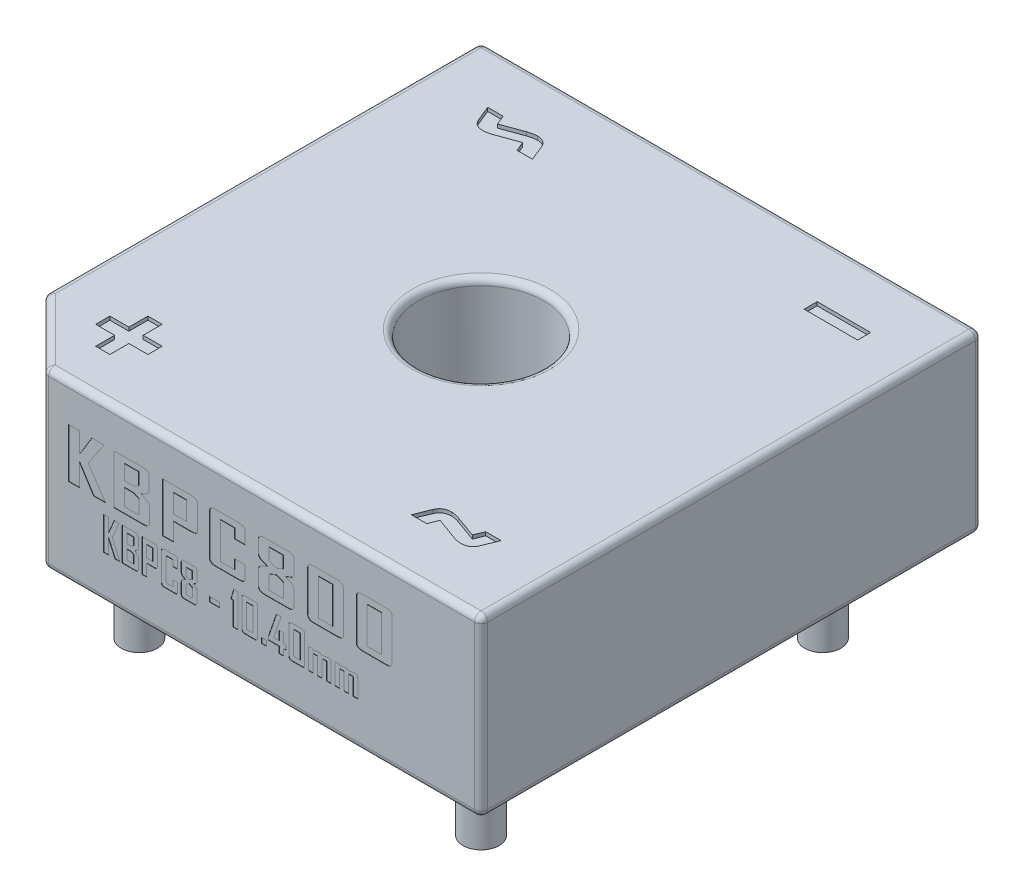
from build123d import *

# Parameters (mm, degrees)
BODY_SKETCH_W          = 15.24
BODY_SKETCH_H          = 15.24
BODY_SKETCH_R          = 1.905
BODY_MAIN_DEPTH        = 5.334
BODY_CHAMFER_SIZE      = 2
SKETCH24_R             = 2.405
BODY_CUT_DEPTH         = 2
BODY_REVOLVE_CUT_REACH = 22.831
BODY_FILLET_R          = 0.2
PIN_B1_SKETCH_R        = 0.55
CIRPATTERN1_COUNT      = 4
TEXT_START             = 2.41
TEXT_2_OUTLINE_W       = 0.192771084
TEXT_2_OUTLINE_H       = 0.710843374
TEXT_2_OUTLINE_W_2     = 0.43373494
TEXT_2_OUTLINE_H_2     = 1.102409638
TEXT_2_OUTLINE_W_3     = 0.397590362
TEXT_2_OUTLINE_H_3     = 0.560240964
TEXT_2_OUTLINE_W_4     = 0.180722891
TEXT_2_OUTLINE_H_4     = 0.349397591
TEXT_2_OUTLINE_W_5     = 0.144578313
TEXT_2_OUTLINE_H_5     = 0.156626506
TEXT_2_OUTLINE_W_6     = 0.301204819
TEXT_2_OUTLINE_H_6     = 0.144578314
TEXT_2_DEPTH           = 0.01
SKETCH23_W             = 1.626506024
SKETCH23_H             = 0.397590362
TEXT1_DEPTH            = 0.11
PIN1_MARK_DEPTH        = 0.04


# Read off the part's stored shape, not the designer's step: text
with BuildPart() as part:
    # BODY_Sketch → BODY_MAIN (new body)
    with BuildSketch(Plane(origin=(0, 0.1, 0), x_dir=(1, 0, 0), z_dir=(0, 1, 0))):
        with Locations((5.2, 5.2)):
            Rectangle(BODY_SKETCH_W, BODY_SKETCH_H)
        with Locations(Location((5.2, 5.2, 0), (0, 0, 90))):
            Circle(BODY_SKETCH_R, mode=Mode.SUBTRACT)
    extrude(amount=BODY_MAIN_DEPTH)

    # BODY_Chamfer
    body_chamfer_edges = [part.edges().sort_by_distance(p)[0] for p in [
        (-2.42, 2.767, 2.42),
    ]]
    chamfer(body_chamfer_edges, length=BODY_CHAMFER_SIZE)

    # Sketch24 → BODY_Cut (cut)
    with BuildSketch(Plane(origin=(0, 0.1, 0), x_dir=(1, 0, 0), z_dir=(0, 1, 0))):
        Polygon((-0.005786438, -1.42), (11.82, -1.42), (11.82, 11.82), (-1.42, 11.82), (-1.42, -0.005786438), align=None)
        with Locations(Location((5.2, 5.2, 0), (0, 0, 270))):
            Circle(SKETCH24_R, mode=Mode.SUBTRACT)
    extrude(amount=BODY_CUT_DEPTH, mode=Mode.SUBTRACT)

    # Sketch26 → BODY_Revolve (revolve)
    with BuildSketch(Plane(origin=(0, 0, 0), x_dir=(0, -1, 0), z_dir=(0.7071067811865455, 0, 0.7071067811865496)), mode=Mode.PRIVATE) as body_revolve_sk:
        with BuildLine():
            Line((-0.4, 16.716004307), (-2.3, 16.716004307))
            Line((-2.3, 16.716004307), (-2.3, 9.758910524))
            Line((-2.3, 9.758910524), (-0.4, 9.758910524))
            add(Edge.make_bspline(
                [(-0.4, 16.716004307), (-0.4, 16.18992751), (-0.85737047, 13.209966353), (-3.515826154, 10.386282777), (-0.4, 9.758910524)],
                knots=[0, 0, 0, 0, 0.257350515, 1, 1, 1, 1], degree=3))
        make_face()
    revolve(body_revolve_sk.sketch.rotate(Axis((5.2, 9.583169558, -5.2), (0, -1, 0)), 135), axis=Axis((5.2, 9.583169558, -5.2), (0, -1, 0)))

    # Sketch28 → BODY_Revolve_Cut (cut, up to next)
    with BuildSketch(Plane(origin=(0, 2.3, 0), x_dir=(1, 0, 0), z_dir=(0, 1, 0)), mode=Mode.PRIVATE) as body_revolve_cut_sk1:
        with BuildLine():
            Line((-2.42, -0.239154346), (-2.42, 10.639154346))
            ThreePointArc((-2.42, 10.639154346), (-4.162093783, 5.2), (-2.42, -0.239154346))
        make_face()
    body_revolve_cut_tool1 = extrude(body_revolve_cut_sk1.sketch, amount=-BODY_REVOLVE_CUT_REACH, mode=Mode.PRIVATE) & part.part
    # Sketch28 → BODY_Revolve_Cut (cut, up to next)
    with BuildSketch(Plane(origin=(0, 2.3, 0), x_dir=(1, 0, 0), z_dir=(0, 1, 0)), mode=Mode.PRIVATE) as body_revolve_cut_sk2:
        with BuildLine():
            Line((12.82, 10.639154346), (12.82, -0.239154346))
            ThreePointArc((12.82, -0.239154346), (14.562093783, 5.2), (12.82, 10.639154346))
        make_face()
    body_revolve_cut_tool2 = extrude(body_revolve_cut_sk2.sketch, amount=-BODY_REVOLVE_CUT_REACH, mode=Mode.PRIVATE) & part.part
    # Sketch28 → BODY_Revolve_Cut (cut, up to next)
    with BuildSketch(Plane(origin=(0, 2.3, 0), x_dir=(1, 0, 0), z_dir=(0, 1, 0)), mode=Mode.PRIVATE) as body_revolve_cut_sk3:
        with BuildLine():
            Line((10.639154346, -2.42), (-0.239154346, -2.42))
            ThreePointArc((-0.239154346, -2.42), (5.2, -4.162093783), (10.639154346, -2.42))
        make_face()
    body_revolve_cut_tool3 = extrude(body_revolve_cut_sk3.sketch, amount=-BODY_REVOLVE_CUT_REACH, mode=Mode.PRIVATE) & part.part
    # Sketch28 → BODY_Revolve_Cut (cut, up to next)
    with BuildSketch(Plane(origin=(0, 2.3, 0), x_dir=(1, 0, 0), z_dir=(0, 1, 0)), mode=Mode.PRIVATE) as body_revolve_cut_sk4:
        with BuildLine():
            ThreePointArc((10.639154346, 12.82), (5.2, 14.562093783), (-0.239154346, 12.82))
            Line((-0.239154346, 12.82), (10.639154346, 12.82))
        make_face()
    body_revolve_cut_tool4 = extrude(body_revolve_cut_sk4.sketch, amount=-BODY_REVOLVE_CUT_REACH, mode=Mode.PRIVATE) & part.part
    add(body_revolve_cut_tool1.solids().sort_by_distance((-3.122712, 2.3, -5.2))[0], mode=Mode.SUBTRACT)
    add(body_revolve_cut_tool2.solids().sort_by_distance((13.522712, 2.3, -5.2))[0], mode=Mode.SUBTRACT)
    add(body_revolve_cut_tool3.solids().sort_by_distance((5.2, 2.3, 3.122712))[0], mode=Mode.SUBTRACT)
    add(body_revolve_cut_tool4.solids().sort_by_distance((5.2, 2.3, -13.522712))[0], mode=Mode.SUBTRACT)

    # BODY_Fillet
    body_fillet_edges = [part.edges().sort_by_distance(p)[0] for p in [
        (5.2, 5.434, -3.295),
        (12.82, 5.434, -5.2),
        (5.2, 5.434, -12.82),
        (6.2, 0.1, 2.42),
        (6.2, 5.434, 2.42),
        (-0.42, 2.767, 2.42),
        (-1.42, 0.1, 1.42),
        (-2.42, 2.767, 0.42),
        (-1.42, 5.434, 1.42),
        (-2.42, 5.434, -6.2),
        (5.2, 0.1, -12.82),
        (12.82, 0.1, -5.2),
        (-2.42, 0.1, -6.2),
        (-2.42, 2.767, -12.82),
        (12.82, 2.767, -12.82),
        (12.82, 2.767, 2.42),
    ]]
    fillet(body_fillet_edges, radius=BODY_FILLET_R)

    # PIN_Sweep: sweep along a path in PIN_B1_Path
    with BuildLine(Plane(origin=(0, 0, 0), x_dir=(0, 0, -1), z_dir=(1, 0, 0))) as pin_sweep_path:
        Line((0, -2.7), (0, 0))
        Line((0, 0), (0, 2.767))
    # PIN_B1_Sketch → PIN_Sweep (sweep)
    with BuildSketch(Plane(origin=(0, 0, 0), x_dir=(1, 0, 0), z_dir=(0, 1, 0))):
        Circle(PIN_B1_SKETCH_R)
    pin_sweep = sweep(path=pin_sweep_path.line)

    # CirPattern1: PIN_Sweep ×4 about axis
    cirpattern1_axis = Axis((5.2, 0, -5.2), (0, 1, 0))
    for i in range(1, CIRPATTERN1_COUNT):
        add(pin_sweep.rotate(cirpattern1_axis, i * 360 / CIRPATTERN1_COUNT))

    # text 2 outline → text 2 (cut)
    # profile 1 of 20: a face of its own
    with BuildSketch(Plane.XY.offset(TEXT_START)):
        with BuildLine():
            add(Edge.make_bspline(
                [(8.513253012, 2.038921687), (8.529255245, 2.042432438), (8.561199851, 2.049440808), (8.593135762, 2.056488688), (8.609073795, 2.060006024)],
                knots=[0, 0, 0, 0, 0.500936953, 1, 1, 1, 1], degree=3))
            Line((8.513253012, 2.038921687), (8.513253012, 2.072054217))
            Line((8.513253012, 2.072054217), (8.368674699, 2.072054217))
            Line((8.368674699, 2.072054217), (8.368674699, 1.4335))
            Line((8.368674699, 1.4335), (8.513253012, 1.4335))
            Line((8.513253012, 1.4335), (8.513253012, 1.950066265))
            Line((8.513253012, 1.950066265), (8.645783133, 1.951572289))
            Line((8.645783133, 1.951572289), (8.645783133, 1.4335))
            Line((8.645783133, 1.4335), (8.790361446, 1.4335))
            Line((8.790361446, 1.4335), (8.790361446, 1.950066265))
            Line((8.790361446, 1.950066265), (8.922891566, 1.951572289))
            Line((8.922891566, 1.951572289), (8.922891566, 1.4335))
            Line((8.922891566, 1.4335), (9.06746988, 1.4335))
            Line((9.06746988, 1.4335), (9.06746988, 1.993176205))
            add(Edge.make_bspline(
                [(8.98313253, 2.072054217), (8.989617158, 2.071753553), (9.001902697, 2.071183926), (9.019087718, 2.067281632), (9.033740797, 2.060818334), (9.045942795, 2.052070007), (9.055528557, 2.040703183), (9.062275757, 2.026869843), (9.066417415, 2.010724643), (9.067107031, 1.999226215), (9.06746988, 1.993176205)],
                knots=[0, 0, 0, 0, 0.148290832, 0.280946377, 0.400455298, 0.512425211, 0.621411208, 0.736958176, 0.861597969, 1, 1, 1, 1], degree=3))
            add(Edge.make_bspline(
                [(8.87940512, 2.057746988), (8.889996883, 2.059889603), (8.909871982, 2.06391015), (8.937800305, 2.06846172), (8.961801885, 2.071319783), (8.976475092, 2.071824995), (8.98313253, 2.072054217)],
                knots=[0, 0, 0, 0, 0.309141697, 0.580094407, 0.809483008, 1, 1, 1, 1], degree=3))
            add(Edge.make_bspline(
                [(8.776995482, 2.036286145), (8.794070044, 2.03977019), (8.82824439, 2.046743426), (8.862343155, 2.05407733), (8.87940512, 2.057746988)],
                knots=[0, 0, 0, 0, 0.499630991, 1, 1, 1, 1], degree=3))
            add(Edge.make_bspline(
                [(8.706024096, 2.072054217), (8.710423382, 2.071959163), (8.718818554, 2.071777772), (8.730808863, 2.070049379), (8.741601876, 2.067328311), (8.751109743, 2.063277842), (8.759641446, 2.058420693), (8.766742267, 2.052130731), (8.772885402, 2.044867551), (8.775607684, 2.039183717), (8.776995482, 2.036286145)],
                knots=[0, 0, 0, 0, 0.156270314, 0.29821119, 0.429671568, 0.550627586, 0.664617534, 0.776870433, 0.88625033, 1, 1, 1, 1], degree=3))
            add(Edge.make_bspline(
                [(8.609073795, 2.060006024), (8.618346503, 2.061846616), (8.636081608, 2.065366955), (8.66158936, 2.069078016), (8.684640438, 2.0715487), (8.69917894, 2.071892395), (8.706024096, 2.072054217)],
                knots=[0, 0, 0, 0, 0.289803378, 0.554281819, 0.790142707, 1, 1, 1, 1], degree=3))
        make_face()
    # profile 2 of 20: a face of its own
    with BuildSketch(Plane.XY.offset(TEXT_START)):
        with BuildLine():
            add(Edge.make_bspline(
                [(7.706024096, 2.038921687), (7.72202633, 2.042432438), (7.753970935, 2.049440808), (7.785906846, 2.056488688), (7.80184488, 2.060006024)],
                knots=[0, 0, 0, 0, 0.500936953, 1, 1, 1, 1], degree=3))
            Line((7.706024096, 2.038921687), (7.706024096, 2.072054217))
            Line((7.706024096, 2.072054217), (7.561445783, 2.072054217))
            Line((7.561445783, 2.072054217), (7.561445783, 1.4335))
            Line((7.561445783, 1.4335), (7.706024096, 1.4335))
            Line((7.706024096, 1.4335), (7.706024096, 1.950066265))
            Line((7.706024096, 1.950066265), (7.838554217, 1.951572289))
            Line((7.838554217, 1.951572289), (7.838554217, 1.4335))
            Line((7.838554217, 1.4335), (7.98313253, 1.4335))
            Line((7.98313253, 1.4335), (7.98313253, 1.950066265))
            Line((7.98313253, 1.950066265), (8.115662651, 1.951572289))
            Line((8.115662651, 1.951572289), (8.115662651, 1.4335))
            Line((8.115662651, 1.4335), (8.260240964, 1.4335))
            Line((8.260240964, 1.4335), (8.260240964, 1.993176205))
            add(Edge.make_bspline(
                [(8.175903614, 2.072054217), (8.182388243, 2.071753553), (8.194673782, 2.071183926), (8.211858802, 2.067281632), (8.226511881, 2.060818334), (8.238713879, 2.052070007), (8.248299641, 2.040703183), (8.255046842, 2.026869843), (8.259188499, 2.010724643), (8.259878115, 1.999226215), (8.260240964, 1.993176205)],
                knots=[0, 0, 0, 0, 0.148290832, 0.280946377, 0.400455298, 0.512425211, 0.621411208, 0.736958176, 0.861597969, 1, 1, 1, 1], degree=3))
            add(Edge.make_bspline(
                [(8.072176205, 2.057746988), (8.082767967, 2.059889603), (8.102643066, 2.06391015), (8.130571389, 2.06846172), (8.15457297, 2.071319783), (8.169246177, 2.071824995), (8.175903614, 2.072054217)],
                knots=[0, 0, 0, 0, 0.309141697, 0.580094407, 0.809483008, 1, 1, 1, 1], degree=3))
            add(Edge.make_bspline(
                [(7.969766566, 2.036286145), (7.986841128, 2.03977019), (8.021015474, 2.046743426), (8.055114239, 2.05407733), (8.072176205, 2.057746988)],
                knots=[0, 0, 0, 0, 0.499630991, 1, 1, 1, 1], degree=3))
            add(Edge.make_bspline(
                [(7.898795181, 2.072054217), (7.903194466, 2.071959163), (7.911589639, 2.071777772), (7.923579947, 2.070049379), (7.93437296, 2.067328311), (7.943880827, 2.063277842), (7.95241253, 2.058420693), (7.959513351, 2.052130731), (7.965656486, 2.044867551), (7.968378768, 2.039183717), (7.969766566, 2.036286145)],
                knots=[0, 0, 0, 0, 0.156270314, 0.29821119, 0.429671568, 0.550627586, 0.664617534, 0.776870433, 0.88625033, 1, 1, 1, 1], degree=3))
            add(Edge.make_bspline(
                [(7.80184488, 2.060006024), (7.811117587, 2.061846616), (7.828852692, 2.065366955), (7.854360445, 2.069078016), (7.877411522, 2.0715487), (7.891950024, 2.071892395), (7.898795181, 2.072054217)],
                knots=[0, 0, 0, 0, 0.289803378, 0.554281819, 0.790142707, 1, 1, 1, 1], degree=3))
        make_face()
    # profile 3 of 20: a face of its own
    with BuildSketch(Plane.XY.offset(TEXT_START)):
        with BuildLine():
            add(Edge.make_bspline(
                [(7.453012048, 1.512378012), (7.45258675, 1.506385605), (7.451783459, 1.495067306), (7.447521289, 1.479288213), (7.441267364, 1.465565602), (7.432047344, 1.454464704), (7.420946446, 1.445244684), (7.407223835, 1.438990759), (7.391444742, 1.434728589), (7.380126444, 1.433925298), (7.374134036, 1.4335)],
                knots=[0, 0, 0, 0, 0.143087679, 0.270260174, 0.38817721, 0.5, 0.61182279, 0.729739826, 0.856912321, 1, 1, 1, 1], degree=3))
            Line((7.453012048, 1.512378012), (7.453012048, 2.354621988))
            add(Edge.make_bspline(
                [(7.374134036, 2.4335), (7.380126444, 2.433074702), (7.391444742, 2.432271411), (7.407223835, 2.428009241), (7.420946446, 2.421755316), (7.432047344, 2.412535296), (7.441267364, 2.401434398), (7.447521289, 2.387711787), (7.451783459, 2.371932694), (7.45258675, 2.360614395), (7.453012048, 2.354621988)],
                knots=[0, 0, 0, 0, 0.143087679, 0.270260174, 0.38817721, 0.5, 0.61182279, 0.729739826, 0.856912321, 1, 1, 1, 1], degree=3))
            Line((7.374134036, 2.4335), (7.052033133, 2.4335))
            add(Edge.make_bspline(
                [(6.971084337, 2.354621988), (6.971492646, 2.360617466), (6.972264978, 2.371958173), (6.976759298, 2.387740236), (6.983239658, 2.401376024), (6.992434459, 2.412669706), (7.003948644, 2.421741146), (7.018060836, 2.428049964), (7.034298158, 2.432241356), (7.045918451, 2.433066044), (7.052033133, 2.4335)],
                knots=[0, 0, 0, 0, 0.141191735, 0.267070268, 0.384070853, 0.494411966, 0.607065164, 0.726092805, 0.855868051, 1, 1, 1, 1], degree=3))
            Line((6.971084337, 2.354621988), (6.971084337, 1.512378012))
            add(Edge.make_bspline(
                [(7.049962349, 1.4335), (7.043969942, 1.433925298), (7.032651643, 1.434728589), (7.01687255, 1.438990759), (7.003149939, 1.445244684), (6.992049041, 1.454464704), (6.982829022, 1.465565602), (6.976575096, 1.479288213), (6.972312926, 1.495067306), (6.971509635, 1.506385605), (6.971084337, 1.512378012)],
                knots=[0, 0, 0, 0, 0.143087679, 0.270260174, 0.38817721, 0.5, 0.61182279, 0.729739826, 0.856912321, 1, 1, 1, 1], degree=3))
            Line((7.049962349, 1.4335), (7.374134036, 1.4335))
        make_face()
        with Locations((7.212048193, 1.9335)):
            Rectangle(TEXT_2_OUTLINE_W, TEXT_2_OUTLINE_H, mode=Mode.SUBTRACT)
    # profile 4 of 20: a face of its own
    with BuildSketch(Plane.XY.offset(TEXT_START)):
        with BuildLine():
            add(Edge.make_bspline(
                [(2.392771084, 1.512378012), (2.392345787, 1.506385605), (2.391542495, 1.495067306), (2.387280325, 1.479288213), (2.3810264, 1.465565602), (2.371806381, 1.454464704), (2.360705483, 1.445244684), (2.346982872, 1.438990759), (2.331203778, 1.434728589), (2.31988548, 1.433925298), (2.313893072, 1.4335)],
                knots=[0, 0, 0, 0, 0.143087679, 0.270260174, 0.38817721, 0.5, 0.61182279, 0.729739826, 0.856912321, 1, 1, 1, 1], degree=3))
            Line((2.392771084, 1.512378012), (2.392771084, 1.791745482))
            add(Edge.make_bspline(
                [(2.359450301, 1.883048193), (2.364565408, 1.877158419), (2.37488931, 1.865270995), (2.385406677, 1.843359827), (2.391745847, 1.818522305), (2.392418701, 1.800948922), (2.392771084, 1.791745482)],
                knots=[0, 0, 0, 0, 0.233880582, 0.472044868, 0.723502121, 1, 1, 1, 1], degree=3))
            add(Edge.make_bspline(
                [(2.28189006, 1.939524096), (2.287665543, 1.93544868), (2.298477373, 1.92781941), (2.313551409, 1.917107842), (2.326363885, 1.90781161), (2.33716695, 1.900131347), (2.345775158, 1.893719876), (2.352323503, 1.888861372), (2.356743408, 1.885570977), (2.358767539, 1.883684517), (2.359450301, 1.883048193)],
                knots=[0, 0, 0, 0, 0.220969595, 0.413659948, 0.578075155, 0.71580951, 0.828017936, 0.913546243, 0.970838158, 1, 1, 1, 1], degree=3))
            add(Edge.make_bspline(
                [(2.357003012, 1.993740964), (2.356323502, 1.993100396), (2.354336689, 1.991227444), (2.349950168, 1.988245561), (2.343654109, 1.983640383), (2.335517213, 1.977324153), (2.324796245, 1.970218835), (2.312503122, 1.960948222), (2.297809177, 1.950783934), (2.28740488, 1.943424814), (2.28189006, 1.939524096)],
                knots=[0, 0, 0, 0, 0.030202642, 0.08830924, 0.171209504, 0.28295023, 0.421594497, 0.587395026, 0.781297856, 1, 1, 1, 1], degree=3))
            add(Edge.make_bspline(
                [(2.387688253, 2.080902108), (2.387395914, 2.072010421), (2.386839236, 2.055078628), (2.380771634, 2.031321691), (2.371446672, 2.010324722), (2.361751265, 1.999192759), (2.357003012, 1.993740964)],
                knots=[0, 0, 0, 0, 0.28088772, 0.534874023, 0.772208062, 1, 1, 1, 1], degree=3))
            Line((2.387688253, 2.080902108), (2.387688253, 2.354621988))
            add(Edge.make_bspline(
                [(2.31125753, 2.4335), (2.317059934, 2.433067036), (2.328064573, 2.43224589), (2.343382782, 2.428060369), (2.356613843, 2.421684364), (2.367336926, 2.412533749), (2.376077999, 2.401304639), (2.382458926, 2.387757878), (2.386386183, 2.371894033), (2.387237104, 2.360606512), (2.387688253, 2.354621988)],
                knots=[0, 0, 0, 0, 0.140866031, 0.267161677, 0.382887924, 0.494174249, 0.60591769, 0.725745796, 0.854593311, 1, 1, 1, 1], degree=3))
            Line((2.31125753, 2.4335), (1.898795181, 2.4335))
            Line((1.898795181, 2.4335), (1.898795181, 1.4335))
            Line((1.898795181, 1.4335), (2.313893072, 1.4335))
        make_face()
        Polygon((2.248192771, 1.578078313), (2.043373494, 1.578078313), (2.043373494, 1.86723494), (2.173832831, 1.86723494), (2.248192771, 1.825066265), align=None, mode=Mode.SUBTRACT)
        Polygon((2.043373494, 2.288921687), (2.24310994, 2.288921687), (2.24310994, 2.060194277), (2.171385542, 2.011813253), (2.043373494, 2.011813253), align=None, mode=Mode.SUBTRACT)
    # profile 5 of 20: a face of its own
    with BuildSketch(Plane.XY.offset(TEXT_START)):
        with BuildLine():
            add(Edge.make_bspline(
                [(10.112048193, 2.885317018), (10.111283401, 2.876278365), (10.109816531, 2.858942231), (10.100201901, 2.834990262), (10.085894656, 2.814239819), (10.065493657, 2.797744985), (10.040470357, 2.784265222), (10.010040097, 2.77505875), (9.974676035, 2.768839387), (9.949333825, 2.767639002), (9.935843373, 2.767)],
                knots=[0, 0, 0, 0, 0.114098337, 0.218840581, 0.322174175, 0.429434412, 0.547100708, 0.679564678, 0.829422238, 1, 1, 1, 1], degree=3))
            Line((10.112048193, 2.885317018), (10.112048193, 4.148682982))
            add(Edge.make_bspline(
                [(9.935843373, 4.267), (9.949333825, 4.266360998), (9.974676035, 4.265160613), (10.010040097, 4.25894125), (10.040470357, 4.249734778), (10.065493657, 4.236255015), (10.085894656, 4.219760181), (10.100201901, 4.199009738), (10.109816531, 4.175057769), (10.111283401, 4.157721635), (10.112048193, 4.148682982)],
                knots=[0, 0, 0, 0, 0.170577762, 0.320435322, 0.452899292, 0.570565588, 0.677825825, 0.781159419, 0.885901663, 1, 1, 1, 1], degree=3))
            Line((9.935843373, 4.267), (9.208151355, 4.267))
            add(Edge.make_bspline(
                [(9.027710843, 4.148682982), (9.028450034, 4.157731136), (9.029870642, 4.175120262), (9.039879622, 4.199024646), (9.054457701, 4.219874026), (9.075447812, 4.236244688), (9.101001586, 4.249729829), (9.132164303, 4.259009226), (9.168389602, 4.265121642), (9.194380995, 4.266349484), (9.208151355, 4.267)],
                knots=[0, 0, 0, 0, 0.112348161, 0.215915455, 0.318343111, 0.425762474, 0.543690884, 0.676356302, 0.828532073, 1, 1, 1, 1], degree=3))
            Line((9.027710843, 4.148682982), (9.027710843, 2.885317018))
            add(Edge.make_bspline(
                [(9.203915663, 2.767), (9.190425211, 2.767639002), (9.165083001, 2.768839387), (9.12971894, 2.77505875), (9.099288679, 2.784265222), (9.074265379, 2.797744985), (9.05386438, 2.814239819), (9.039557135, 2.834990262), (9.029942505, 2.858942231), (9.028475635, 2.876278365), (9.027710843, 2.885317018)],
                knots=[0, 0, 0, 0, 0.170577762, 0.320435322, 0.452899292, 0.570565588, 0.677825825, 0.781159419, 0.885901663, 1, 1, 1, 1], degree=3))
            Line((9.203915663, 2.767), (9.935843373, 2.767))
        make_face()
        with Locations((9.569879518, 3.517)):
            Rectangle(TEXT_2_OUTLINE_W_2, TEXT_2_OUTLINE_H_2, mode=Mode.SUBTRACT)
    # profile 6 of 20: a face of its own
    with BuildSketch(Plane.XY.offset(TEXT_START)):
        with BuildLine():
            add(Edge.make_bspline(
                [(8.628313253, 2.885317018), (8.627548462, 2.876278365), (8.626081592, 2.858942231), (8.616466961, 2.834990262), (8.602159716, 2.814239819), (8.581758718, 2.797744985), (8.556735417, 2.784265222), (8.526305157, 2.77505875), (8.490941095, 2.768839387), (8.465598886, 2.767639002), (8.452108434, 2.767)],
                knots=[0, 0, 0, 0, 0.114098337, 0.218840581, 0.322174175, 0.429434412, 0.547100708, 0.679564678, 0.829422238, 1, 1, 1, 1], degree=3))
            Line((8.628313253, 2.885317018), (8.628313253, 4.148682982))
            add(Edge.make_bspline(
                [(8.452108434, 4.267), (8.465598886, 4.266360998), (8.490941095, 4.265160613), (8.526305157, 4.25894125), (8.556735417, 4.249734778), (8.581758718, 4.236255015), (8.602159716, 4.219760181), (8.616466961, 4.199009738), (8.626081592, 4.175057769), (8.627548462, 4.157721635), (8.628313253, 4.148682982)],
                knots=[0, 0, 0, 0, 0.170577762, 0.320435322, 0.452899292, 0.570565588, 0.677825825, 0.781159419, 0.885901663, 1, 1, 1, 1], degree=3))
            Line((8.452108434, 4.267), (7.724416416, 4.267))
            add(Edge.make_bspline(
                [(7.543975904, 4.148682982), (7.544715094, 4.157731136), (7.546135703, 4.175120262), (7.556144682, 4.199024646), (7.570722761, 4.219874026), (7.591712872, 4.236244688), (7.617266646, 4.249729829), (7.648429364, 4.259009226), (7.684654662, 4.265121642), (7.710646055, 4.266349484), (7.724416416, 4.267)],
                knots=[0, 0, 0, 0, 0.112348161, 0.215915455, 0.318343111, 0.425762474, 0.543690884, 0.676356302, 0.828532073, 1, 1, 1, 1], degree=3))
            Line((7.543975904, 4.148682982), (7.543975904, 2.885317018))
            add(Edge.make_bspline(
                [(7.720180723, 2.767), (7.706690271, 2.767639002), (7.681348062, 2.768839387), (7.645984, 2.77505875), (7.61555374, 2.784265222), (7.590530439, 2.797744985), (7.57012944, 2.814239819), (7.555822195, 2.834990262), (7.546207565, 2.858942231), (7.544740695, 2.876278365), (7.543975904, 2.885317018)],
                knots=[0, 0, 0, 0, 0.170577762, 0.320435322, 0.452899292, 0.570565588, 0.677825825, 0.781159419, 0.885901663, 1, 1, 1, 1], degree=3))
            Line((7.720180723, 2.767), (8.452108434, 2.767))
        make_face()
        with Locations((8.086144578, 3.517)):
            Rectangle(TEXT_2_OUTLINE_W_2, TEXT_2_OUTLINE_H_2, mode=Mode.SUBTRACT)
    # profile 7 of 20: a face of its own
    with BuildSketch(Plane.XY.offset(TEXT_START)):
        with BuildLine():
            add(Edge.make_bspline(
                [(7.126506024, 2.885317018), (7.125741233, 2.876278365), (7.124274363, 2.858942231), (7.114659733, 2.834990262), (7.100352488, 2.814239819), (7.079951489, 2.797744985), (7.054928188, 2.784265222), (7.024497928, 2.77505875), (6.989133866, 2.768839387), (6.963791657, 2.767639002), (6.950301205, 2.767)],
                knots=[0, 0, 0, 0, 0.114098337, 0.218840581, 0.322174175, 0.429434412, 0.547100708, 0.679564678, 0.829422238, 1, 1, 1, 1], degree=3))
            Line((7.126506024, 2.885317018), (7.126506024, 3.336277108))
            add(Edge.make_bspline(
                [(7.045463102, 3.471819277), (7.05185318, 3.467800966), (7.064306728, 3.459969726), (7.081121768, 3.446466653), (7.095180437, 3.431312465), (7.106440271, 3.414740663), (7.115814973, 3.39716126), (7.121803806, 3.377893773), (7.126052732, 3.357548256), (7.12635308, 3.343454147), (7.126506024, 3.336277108)],
                knots=[0, 0, 0, 0, 0.136181974, 0.265403463, 0.38803493, 0.507736252, 0.626274456, 0.746084242, 0.870700354, 1, 1, 1, 1], degree=3))
            add(Edge.make_bspline(
                [(6.854574548, 3.553144578), (6.886287987, 3.539573476), (6.949874088, 3.512363134), (7.013546951, 3.485356438), (7.045463102, 3.471819277)],
                knots=[0, 0, 0, 0, 0.498747964, 1, 1, 1, 1], degree=3))
            add(Edge.make_bspline(
                [(7.042356928, 3.627975151), (7.011102078, 3.615562622), (6.948478729, 3.590692431), (6.88591379, 3.565675663), (6.854574548, 3.553144578)],
                knots=[0, 0, 0, 0, 0.499092595, 1, 1, 1, 1], degree=3))
            add(Edge.make_bspline(
                [(7.126506024, 3.751939759), (7.126232693, 3.745515109), (7.125696734, 3.732917413), (7.121513934, 3.71458958), (7.115214613, 3.697185039), (7.105470116, 3.681294072), (7.093840346, 3.665936698), (7.079101363, 3.652073043), (7.061854894, 3.639098824), (7.04903719, 3.631786269), (7.042356928, 3.627975151)],
                knots=[0, 0, 0, 0, 0.121828503, 0.238885935, 0.355369217, 0.471509396, 0.591236453, 0.72013196, 0.854139859, 1, 1, 1, 1], degree=3))
            Line((7.126506024, 3.751939759), (7.126506024, 4.148682982))
            add(Edge.make_bspline(
                [(6.94747741, 4.267), (6.961156239, 4.266361526), (6.986872733, 4.26516118), (7.022788032, 4.25892246), (7.05371362, 4.249793736), (7.079083814, 4.236251836), (7.099770774, 4.21977915), (7.114345317, 4.19903383), (7.124343996, 4.175117726), (7.125766071, 4.157730268), (7.126506024, 4.148682982)],
                knots=[0, 0, 0, 0, 0.171226624, 0.321909738, 0.455297795, 0.57282812, 0.679922848, 0.782908436, 0.88703987, 1, 1, 1, 1], degree=3))
            Line((6.94747741, 4.267), (6.225432982, 4.267))
            add(Edge.make_bspline(
                [(6.042168675, 4.148682982), (6.04303288, 4.157722964), (6.044692579, 4.175084175), (6.054557895, 4.199129091), (6.069523275, 4.219770384), (6.090547165, 4.236423193), (6.11663908, 4.249693006), (6.148229543, 4.258975707), (6.185012332, 4.265159156), (6.211379983, 4.266359996), (6.225432982, 4.267)],
                knots=[0, 0, 0, 0, 0.111417883, 0.213977126, 0.316089084, 0.422462903, 0.541300439, 0.674889882, 0.82672813, 1, 1, 1, 1], degree=3))
            Line((6.042168675, 4.148682982), (6.042168675, 3.751939759))
            add(Edge.make_bspline(
                [(6.12716491, 3.627975151), (6.120398933, 3.631888983), (6.107405427, 3.639405177), (6.089919916, 3.652429526), (6.075456816, 3.666790697), (6.063129526, 3.681651692), (6.053569046, 3.697712257), (6.04709367, 3.714936439), (6.043012122, 3.73311338), (6.042452177, 3.745611777), (6.042168675, 3.751939759)],
                knots=[0, 0, 0, 0, 0.147951841, 0.284129419, 0.411432356, 0.533081905, 0.648939396, 0.763473073, 0.880245584, 1, 1, 1, 1], degree=3))
            add(Edge.make_bspline(
                [(6.313817771, 3.553144578), (6.282666785, 3.565675594), (6.220478362, 3.590691947), (6.158231508, 3.615562553), (6.12716491, 3.627975151)],
                knots=[0, 0, 0, 0, 0.500912952, 1, 1, 1, 1], degree=3))
            add(Edge.make_bspline(
                [(6.122082078, 3.471819277), (6.153886154, 3.485398682), (6.217733385, 3.512659572), (6.281709788, 3.53961593), (6.313817771, 3.553144578)],
                knots=[0, 0, 0, 0, 0.49812771, 1, 1, 1, 1], degree=3))
            add(Edge.make_bspline(
                [(6.042168675, 3.336277108), (6.042323728, 3.343453044), (6.042628218, 3.357544985), (6.046847328, 3.377906107), (6.052931096, 3.397076409), (6.061879947, 3.414829125), (6.073243576, 3.431209334), (6.086951576, 3.44647595), (6.103517129, 3.459964434), (6.115786995, 3.467799485), (6.122082078, 3.471819277)],
                knots=[0, 0, 0, 0, 0.129903277, 0.255101155, 0.375470268, 0.493788733, 0.614048876, 0.736100546, 0.864605761, 1, 1, 1, 1], degree=3))
            Line((6.042168675, 3.336277108), (6.042168675, 2.885317018))
            add(Edge.make_bspline(
                [(6.218373494, 2.767), (6.204883042, 2.767639002), (6.179540833, 2.768839387), (6.144176771, 2.77505875), (6.113746511, 2.784265222), (6.08872321, 2.797744985), (6.068322211, 2.814239819), (6.054014966, 2.834990262), (6.044400336, 2.858942231), (6.042933466, 2.876278365), (6.042168675, 2.885317018)],
                knots=[0, 0, 0, 0, 0.170577762, 0.320435322, 0.452899292, 0.570565588, 0.677825825, 0.781159419, 0.885901663, 1, 1, 1, 1], degree=3))
            Line((6.218373494, 2.767), (6.950301205, 2.767))
        make_face()
        Polygon((6.801204819, 2.947722892), (6.36746988, 2.947722892), (6.36746988, 3.375810241), (6.584337349, 3.462500753), (6.801204819, 3.375810241), align=None, mode=Mode.SUBTRACT)
        Polygon((6.798381024, 3.727372741), (6.584337349, 3.641246988), (6.37311747, 3.727372741), (6.37311747, 4.086277108), (6.798381024, 4.086277108), align=None, mode=Mode.SUBTRACT)
    # profile 8 of 20: a face of its own
    with BuildSketch(Plane.XY.offset(TEXT_START)):
        with BuildLine():
            add(Edge.make_bspline(
                [(5.642771084, 2.885317018), (5.642006293, 2.876278365), (5.640539423, 2.858942231), (5.630924793, 2.834990262), (5.616617548, 2.814239819), (5.596216549, 2.797744985), (5.571193248, 2.784265222), (5.540762988, 2.77505875), (5.505398926, 2.768839387), (5.480056717, 2.767639002), (5.466566265, 2.767)],
                knots=[0, 0, 0, 0, 0.114098337, 0.218840581, 0.322174175, 0.429434412, 0.547100708, 0.679564678, 0.829422238, 1, 1, 1, 1], degree=3))
            Line((5.642771084, 2.885317018), (5.642771084, 3.254951807))
            Line((5.642771084, 3.254951807), (5.31746988, 3.254951807))
            Line((5.31746988, 3.254951807), (5.31746988, 2.965795181))
            Line((5.31746988, 2.965795181), (4.88373494, 2.965795181))
            Line((4.88373494, 2.965795181), (4.88373494, 4.068204819))
            Line((4.88373494, 4.068204819), (5.31746988, 4.068204819))
            Line((5.31746988, 4.068204819), (5.31746988, 3.779048193))
            Line((5.31746988, 3.779048193), (5.642771084, 3.779048193))
            Line((5.642771084, 3.779048193), (5.642771084, 4.148682982))
            add(Edge.make_bspline(
                [(5.466566265, 4.267), (5.480056717, 4.266360998), (5.505398926, 4.265160613), (5.540762988, 4.25894125), (5.571193248, 4.249734778), (5.596216549, 4.236255015), (5.616617548, 4.219760181), (5.630924793, 4.199009738), (5.640539423, 4.175057769), (5.642006293, 4.157721635), (5.642771084, 4.148682982)],
                knots=[0, 0, 0, 0, 0.170577762, 0.320435322, 0.452899292, 0.570565588, 0.677825825, 0.781159419, 0.885901663, 1, 1, 1, 1], degree=3))
            Line((5.466566265, 4.267), (4.734638554, 4.267))
            add(Edge.make_bspline(
                [(4.558433735, 4.148682982), (4.559198526, 4.157721635), (4.560665396, 4.175057769), (4.570280027, 4.199009738), (4.584587272, 4.219760181), (4.60498827, 4.236255015), (4.630011571, 4.249734778), (4.660441831, 4.25894125), (4.695805893, 4.265160613), (4.721148102, 4.266360998), (4.734638554, 4.267)],
                knots=[0, 0, 0, 0, 0.114098337, 0.218840581, 0.322174175, 0.429434412, 0.547100708, 0.679564678, 0.829422238, 1, 1, 1, 1], degree=3))
            Line((4.558433735, 4.148682982), (4.558433735, 2.885317018))
            add(Edge.make_bspline(
                [(4.734638554, 2.767), (4.721148102, 2.767639002), (4.695805893, 2.768839387), (4.660441831, 2.77505875), (4.630011571, 2.784265222), (4.60498827, 2.797744985), (4.584587272, 2.814239819), (4.570280027, 2.834990262), (4.560665396, 2.858942231), (4.559198526, 2.876278365), (4.558433735, 2.885317018)],
                knots=[0, 0, 0, 0, 0.170577762, 0.320435322, 0.452899292, 0.570565588, 0.677825825, 0.781159419, 0.885901663, 1, 1, 1, 1], degree=3))
            Line((4.734638554, 2.767), (5.466566265, 2.767))
        make_face()
    # profile 9 of 20: a face of its own
    with BuildSketch(Plane.XY.offset(TEXT_START)):
        with BuildLine():
            add(Edge.make_bspline(
                [(4.195180723, 3.427485693), (4.194415931, 3.41844704), (4.192949062, 3.401110906), (4.183334431, 3.377158937), (4.169027186, 3.356408494), (4.148626187, 3.33991366), (4.123602887, 3.326433896), (4.093172627, 3.317227424), (4.057808565, 3.311008062), (4.032466356, 3.309807677), (4.018975904, 3.309168675)],
                knots=[0, 0, 0, 0, 0.114098337, 0.218840581, 0.322174175, 0.429434412, 0.547100708, 0.679564678, 0.829422238, 1, 1, 1, 1], degree=3))
            Line((4.195180723, 3.427485693), (4.195180723, 4.148682982))
            add(Edge.make_bspline(
                [(4.018975904, 4.267), (4.032466356, 4.266360998), (4.057808565, 4.265160613), (4.093172627, 4.25894125), (4.123602887, 4.249734778), (4.148626187, 4.236255015), (4.169027186, 4.219760181), (4.183334431, 4.199009738), (4.192949062, 4.175057769), (4.194415931, 4.157721635), (4.195180723, 4.148682982)],
                knots=[0, 0, 0, 0, 0.170577762, 0.320435322, 0.452899292, 0.570565588, 0.677825825, 0.781159419, 0.885901663, 1, 1, 1, 1], degree=3))
            Line((4.018975904, 4.267), (3.128915663, 4.267))
            Line((3.128915663, 4.267), (3.128915663, 2.767))
            Line((3.128915663, 2.767), (3.454216867, 2.767))
            Line((3.454216867, 2.767), (3.454216867, 3.309168675))
            Line((3.454216867, 3.309168675), (4.018975904, 3.309168675))
        make_face()
        with Locations((3.653012048, 3.788084337)):
            Rectangle(TEXT_2_OUTLINE_W_3, TEXT_2_OUTLINE_H_3, mode=Mode.SUBTRACT)
    # profile 10 of 20: a face of its own
    with BuildSketch(Plane.XY.offset(TEXT_START)):
        with BuildLine():
            add(Edge.make_bspline(
                [(2.729518072, 2.885317018), (2.728753281, 2.876278365), (2.727286411, 2.858942231), (2.717671781, 2.834990262), (2.703364536, 2.814239819), (2.682963537, 2.797744985), (2.657940236, 2.784265222), (2.627509976, 2.77505875), (2.592145914, 2.768839387), (2.566803705, 2.767639002), (2.553313253, 2.767)],
                knots=[0, 0, 0, 0, 0.114098337, 0.218840581, 0.322174175, 0.429434412, 0.547100708, 0.679564678, 0.829422238, 1, 1, 1, 1], degree=3))
            Line((2.729518072, 2.885317018), (2.729518072, 3.322440512))
            add(Edge.make_bspline(
                [(2.6546875, 3.459394578), (2.660638055, 3.455208998), (2.672313745, 3.446996395), (2.687467783, 3.432533806), (2.700473385, 3.417008652), (2.711167823, 3.400448906), (2.719639533, 3.382645952), (2.725023584, 3.36352504), (2.729010977, 3.343406256), (2.729346816, 3.329521049), (2.729518072, 3.322440512)],
                knots=[0, 0, 0, 0, 0.133657493, 0.26225178, 0.383948145, 0.505447312, 0.623949121, 0.745003415, 0.869968602, 1, 1, 1, 1], degree=3))
            add(Edge.make_bspline(
                [(2.479612199, 3.544108434), (2.492606745, 3.538000971), (2.516918317, 3.526574485), (2.550871625, 3.510423057), (2.579945188, 3.496562103), (2.604311533, 3.485060985), (2.623752633, 3.475458496), (2.638402223, 3.468058465), (2.648329204, 3.463218917), (2.653096134, 3.460351741), (2.6546875, 3.459394578)],
                knots=[0, 0, 0, 0, 0.221438922, 0.414291367, 0.579869792, 0.718174277, 0.829838972, 0.91423528, 0.971368777, 1, 1, 1, 1], degree=3))
            add(Edge.make_bspline(
                [(2.64875753, 3.625433735), (2.647165699, 3.624477586), (2.642577832, 3.621721841), (2.63310412, 3.61701016), (2.618851452, 3.610328397), (2.600229917, 3.600865854), (2.576470354, 3.59004747), (2.548475951, 3.576368019), (2.515620761, 3.56084559), (2.492137518, 3.549930333), (2.479612199, 3.544108434)],
                knots=[0, 0, 0, 0, 0.029670315, 0.085513729, 0.168947239, 0.28130074, 0.41925825, 0.586125272, 0.779250554, 1, 1, 1, 1], degree=3))
            add(Edge.make_bspline(
                [(2.718222892, 3.756175452), (2.717986534, 3.749295185), (2.71752748, 3.735932312), (2.714516733, 3.7164097), (2.708703481, 3.698271222), (2.70106697, 3.68119458), (2.691390404, 3.665185101), (2.679463069, 3.650429042), (2.665160995, 3.636996723), (2.654317215, 3.62935282), (2.64875753, 3.625433735)],
                knots=[0, 0, 0, 0, 0.133406508, 0.259102454, 0.381455931, 0.501515548, 0.621060989, 0.743032877, 0.868251092, 1, 1, 1, 1], degree=3))
            Line((2.718222892, 3.756175452), (2.718222892, 4.148682982))
            add(Edge.make_bspline(
                [(2.547665663, 4.267), (2.560687193, 4.266360983), (2.585190406, 4.265158516), (2.619418999, 4.25890675), (2.648953897, 4.249759111), (2.673158072, 4.236164858), (2.692980266, 4.21973941), (2.70664965, 4.198895781), (2.715937322, 4.175010235), (2.717438621, 4.157716923), (2.718222892, 4.148682982)],
                knots=[0, 0, 0, 0, 0.168128508, 0.316375143, 0.448176834, 0.565139626, 0.672821552, 0.776962353, 0.883486227, 1, 1, 1, 1], degree=3))
            Line((2.547665663, 4.267), (1.645180723, 4.267))
            Line((1.645180723, 4.267), (1.645180723, 2.767))
            Line((1.645180723, 2.767), (2.553313253, 2.767))
        make_face()
        Polygon((2.404216867, 2.947722892), (1.970481928, 2.947722892), (1.970481928, 3.453746988), (2.238177711, 3.453746988), (2.404216867, 3.380045934), align=None, mode=Mode.SUBTRACT)
        Polygon((1.970481928, 4.086277108), (2.392921687, 4.086277108), (2.392921687, 3.713253765), (2.23253012, 3.63446988), (1.970481928, 3.63446988), align=None, mode=Mode.SUBTRACT)
    # profile 11 of 20: a face of its own
    with BuildSketch(Plane.XY.offset(TEXT_START)):
        with BuildLine():
            add(Edge.make_bspline(
                [(2.971084337, 1.873823795), (2.97065904, 1.867831388), (2.969855748, 1.856513089), (2.965593578, 1.840733996), (2.959339653, 1.827011385), (2.950119634, 1.815910487), (2.939018736, 1.806690467), (2.925296125, 1.800436542), (2.909517031, 1.796174372), (2.898198733, 1.795371081), (2.892206325, 1.794945783)],
                knots=[0, 0, 0, 0, 0.143087679, 0.270260174, 0.38817721, 0.5, 0.61182279, 0.729739826, 0.856912321, 1, 1, 1, 1], degree=3))
            Line((2.971084337, 1.873823795), (2.971084337, 2.354621988))
            add(Edge.make_bspline(
                [(2.892206325, 2.4335), (2.898198733, 2.433074702), (2.909517031, 2.432271411), (2.925296125, 2.428009241), (2.939018736, 2.421755316), (2.950119634, 2.412535296), (2.959339653, 2.401434398), (2.965593578, 2.387711787), (2.969855748, 2.371932694), (2.97065904, 2.360614395), (2.971084337, 2.354621988)],
                knots=[0, 0, 0, 0, 0.143087679, 0.270260174, 0.38817721, 0.5, 0.61182279, 0.729739826, 0.856912321, 1, 1, 1, 1], degree=3))
            Line((2.892206325, 2.4335), (2.501204819, 2.4335))
            Line((2.501204819, 2.4335), (2.501204819, 1.4335))
            Line((2.501204819, 1.4335), (2.645783133, 1.4335))
            Line((2.645783133, 1.4335), (2.645783133, 1.794945783))
            Line((2.645783133, 1.794945783), (2.892206325, 1.794945783))
        make_face()
        with Locations((2.736144579, 2.114222892)):
            Rectangle(TEXT_2_OUTLINE_W_4, TEXT_2_OUTLINE_H_4, mode=Mode.SUBTRACT)
    # profile 12 of 20: a face of its own
    with BuildSketch(Plane.XY.offset(TEXT_START)):
        with BuildLine():
            add(Edge.make_bspline(
                [(3.585542169, 1.512378012), (3.585116871, 1.506385605), (3.58431358, 1.495067306), (3.58005141, 1.479288213), (3.573797484, 1.465565602), (3.564577465, 1.454464704), (3.553476567, 1.445244684), (3.539753956, 1.438990759), (3.523974863, 1.434728589), (3.512656564, 1.433925298), (3.506664157, 1.4335)],
                knots=[0, 0, 0, 0, 0.143087679, 0.270260174, 0.38817721, 0.5, 0.61182279, 0.729739826, 0.856912321, 1, 1, 1, 1], degree=3))
            Line((3.585542169, 1.512378012), (3.585542169, 1.758801205))
            Line((3.585542169, 1.758801205), (3.440963855, 1.758801205))
            Line((3.440963855, 1.758801205), (3.440963855, 1.578078313))
            Line((3.440963855, 1.578078313), (3.236144578, 1.578078313))
            Line((3.236144578, 1.578078313), (3.236144578, 2.288921687))
            Line((3.236144578, 2.288921687), (3.440963855, 2.288921687))
            Line((3.440963855, 2.288921687), (3.440963855, 2.108198795))
            Line((3.440963855, 2.108198795), (3.585542169, 2.108198795))
            Line((3.585542169, 2.108198795), (3.585542169, 2.354621988))
            add(Edge.make_bspline(
                [(3.506664157, 2.4335), (3.512656564, 2.433074702), (3.523974863, 2.432271411), (3.539753956, 2.428009241), (3.553476567, 2.421755316), (3.564577465, 2.412535296), (3.573797484, 2.401434398), (3.58005141, 2.387711787), (3.58431358, 2.371932694), (3.585116871, 2.360614395), (3.585542169, 2.354621988)],
                knots=[0, 0, 0, 0, 0.143087679, 0.270260174, 0.38817721, 0.5, 0.61182279, 0.729739826, 0.856912321, 1, 1, 1, 1], degree=3))
            Line((3.506664157, 2.4335), (3.170444277, 2.4335))
            add(Edge.make_bspline(
                [(3.091566265, 2.354621988), (3.091991563, 2.360614395), (3.092794854, 2.371932694), (3.097057024, 2.387711787), (3.103310949, 2.401434398), (3.112530969, 2.412535296), (3.123631867, 2.421755316), (3.137354478, 2.428009241), (3.153133571, 2.432271411), (3.16445187, 2.433074702), (3.170444277, 2.4335)],
                knots=[0, 0, 0, 0, 0.143087679, 0.270260174, 0.38817721, 0.5, 0.61182279, 0.729739826, 0.856912321, 1, 1, 1, 1], degree=3))
            Line((3.091566265, 2.354621988), (3.091566265, 1.512378012))
            add(Edge.make_bspline(
                [(3.170444277, 1.4335), (3.16445187, 1.433925298), (3.153133571, 1.434728589), (3.137354478, 1.438990759), (3.123631867, 1.445244684), (3.112530969, 1.454464704), (3.103310949, 1.465565602), (3.097057024, 1.479288213), (3.092794854, 1.495067306), (3.091991563, 1.506385605), (3.091566265, 1.512378012)],
                knots=[0, 0, 0, 0, 0.143087679, 0.270260174, 0.38817721, 0.5, 0.61182279, 0.729739826, 0.856912321, 1, 1, 1, 1], degree=3))
            Line((3.170444277, 1.4335), (3.506664157, 1.4335))
        make_face()
    # profile 13 of 20: a face of its own
    with BuildSketch(Plane.XY.offset(TEXT_START)):
        with BuildLine():
            add(Edge.make_bspline(
                [(4.175903614, 1.512378012), (4.175478317, 1.506385605), (4.174675026, 1.495067306), (4.170412855, 1.479288213), (4.16415893, 1.465565602), (4.154938911, 1.454464704), (4.143838013, 1.445244684), (4.130115402, 1.438990759), (4.114336309, 1.434728589), (4.10301801, 1.433925298), (4.097025602, 1.4335)],
                knots=[0, 0, 0, 0, 0.143087679, 0.270260174, 0.38817721, 0.5, 0.61182279, 0.729739826, 0.856912321, 1, 1, 1, 1], degree=3))
            Line((4.175903614, 1.512378012), (4.175903614, 1.813018072))
            add(Edge.make_bspline(
                [(4.140135542, 1.903379518), (4.143041845, 1.900695244), (4.14877523, 1.895399867), (4.155944018, 1.886094626), (4.162291394, 1.876172203), (4.167047933, 1.865102401), (4.171117672, 1.853369427), (4.173878125, 1.840670125), (4.175599176, 1.827122014), (4.175800555, 1.817792599), (4.175903614, 1.813018072)],
                knots=[0, 0, 0, 0, 0.118103991, 0.232988624, 0.350149624, 0.46942556, 0.592264926, 0.721106772, 0.857270471, 1, 1, 1, 1], degree=3))
            add(Edge.make_bspline(
                [(4.055986446, 1.957596386), (4.069975332, 1.948553121), (4.097997405, 1.930437954), (4.126074701, 1.912408497), (4.140135542, 1.903379518)],
                knots=[0, 0, 0, 0, 0.499209558, 1, 1, 1, 1], degree=3))
            add(Edge.make_bspline(
                [(4.138817771, 2.007483434), (4.125005631, 1.99921179), (4.097353575, 1.982651869), (4.069784719, 1.965953804), (4.055986446, 1.957596386)],
                knots=[0, 0, 0, 0, 0.499497775, 1, 1, 1, 1], degree=3))
            add(Edge.make_bspline(
                [(4.175903614, 2.090126506), (4.175533488, 2.081783064), (4.174820695, 2.06571517), (4.167505687, 2.043066642), (4.155805319, 2.023008739), (4.144513045, 2.012688474), (4.138817771, 2.007483434)],
                knots=[0, 0, 0, 0, 0.266256186, 0.512759176, 0.754259405, 1, 1, 1, 1], degree=3))
            Line((4.175903614, 2.090126506), (4.175903614, 2.354621988))
            add(Edge.make_bspline(
                [(4.095707831, 2.4335), (4.101760865, 2.43306695), (4.113259478, 2.432244309), (4.129302246, 2.428044982), (4.143264748, 2.421758196), (4.154537569, 2.41253825), (4.16400255, 2.401500846), (4.170163585, 2.387672968), (4.174744396, 2.371970185), (4.175502715, 2.360621621), (4.175903614, 2.354621988)],
                knots=[0, 0, 0, 0, 0.143394233, 0.272398068, 0.390691757, 0.502757553, 0.614606492, 0.731558503, 0.858083339, 1, 1, 1, 1], degree=3))
            Line((4.095707831, 2.4335), (3.776054217, 2.4335))
            add(Edge.make_bspline(
                [(3.693975904, 2.354621988), (3.69438905, 2.36061528), (3.695170535, 2.37195185), (3.699610958, 2.387788929), (3.706337191, 2.401389007), (3.715709436, 2.412684932), (3.727381079, 2.421687998), (3.741563879, 2.428094784), (3.758010524, 2.43224787), (3.769815302, 2.433067055), (3.776054217, 2.4335)],
                knots=[0, 0, 0, 0, 0.14019119, 0.265177696, 0.38200548, 0.492494522, 0.605508363, 0.723692524, 0.853969418, 1, 1, 1, 1], degree=3))
            Line((3.693975904, 2.354621988), (3.693975904, 2.090126506))
            add(Edge.make_bspline(
                [(3.731438253, 2.007483434), (3.725674508, 2.012813702), (3.714343292, 2.023292726), (3.702649542, 2.043423785), (3.694992374, 2.065858512), (3.694323069, 2.081838011), (3.693975904, 2.090126506)],
                knots=[0, 0, 0, 0, 0.24977013, 0.491034834, 0.736002027, 1, 1, 1, 1], degree=3))
            add(Edge.make_bspline(
                [(3.813704819, 1.957596386), (3.799965102, 1.965946808), (3.772559324, 1.982602887), (3.745120695, 1.999204791), (3.731438253, 2.007483434)],
                knots=[0, 0, 0, 0, 0.501343828, 1, 1, 1, 1], degree=3))
            add(Edge.make_bspline(
                [(3.729179217, 1.903379518), (3.743230883, 1.91242277), (3.771378632, 1.930537857), (3.799581256, 1.948567393), (3.813704819, 1.957596386)],
                knots=[0, 0, 0, 0, 0.499211022, 1, 1, 1, 1], degree=3))
            add(Edge.make_bspline(
                [(3.693975904, 1.813018072), (3.694072704, 1.817793909), (3.694261851, 1.827125885), (3.696068085, 1.840642623), (3.698519501, 1.853392965), (3.70264484, 1.865108004), (3.707434377, 1.876110462), (3.713524295, 1.886157213), (3.720735679, 1.895333471), (3.726349478, 1.900682993), (3.729179217, 1.903379518)],
                knots=[0, 0, 0, 0, 0.143117701, 0.279651714, 0.408445961, 0.531619404, 0.651219727, 0.767715744, 0.882912821, 1, 1, 1, 1], degree=3))
            Line((3.693975904, 1.813018072), (3.693975904, 1.512378012))
            add(Edge.make_bspline(
                [(3.772853916, 1.4335), (3.766861508, 1.433925298), (3.75554321, 1.434728589), (3.739764116, 1.438990759), (3.726041505, 1.445244684), (3.714940607, 1.454464704), (3.705720588, 1.465565602), (3.699466663, 1.479288213), (3.695204493, 1.495067306), (3.694401201, 1.506385605), (3.693975904, 1.512378012)],
                knots=[0, 0, 0, 0, 0.143087679, 0.270260174, 0.38817721, 0.5, 0.61182279, 0.729739826, 0.856912321, 1, 1, 1, 1], degree=3))
            Line((3.772853916, 1.4335), (4.097025602, 1.4335))
        make_face()
        Polygon((4.031325301, 1.578078313), (3.838554217, 1.578078313), (3.838554217, 1.846338855), (3.934939759, 1.900743976), (4.031325301, 1.846338855), align=None, mode=Mode.SUBTRACT)
        Polygon((3.841001506, 2.288921687), (4.030195783, 2.288921687), (4.030195783, 2.065841867), (3.934939759, 2.012378012), (3.841001506, 2.065841867), align=None, mode=Mode.SUBTRACT)
    # profile 14 of 20: a face of its own
    with BuildSketch(Plane.XY.offset(TEXT_START)):
        with BuildLine():
            add(Edge.make_bspline(
                [(6.019277108, 1.512378012), (6.018851811, 1.506385605), (6.01804852, 1.495067306), (6.013786349, 1.479288213), (6.007532424, 1.465565602), (5.998312405, 1.454464704), (5.987211507, 1.445244684), (5.973488896, 1.438990759), (5.957709803, 1.434728589), (5.946391504, 1.433925298), (5.940399096, 1.4335)],
                knots=[0, 0, 0, 0, 0.143087679, 0.270260174, 0.38817721, 0.5, 0.61182279, 0.729739826, 0.856912321, 1, 1, 1, 1], degree=3))
            Line((6.019277108, 1.512378012), (6.019277108, 2.354621988))
            add(Edge.make_bspline(
                [(5.940399096, 2.4335), (5.946391504, 2.433074702), (5.957709803, 2.432271411), (5.973488896, 2.428009241), (5.987211507, 2.421755316), (5.998312405, 2.412535296), (6.007532424, 2.401434398), (6.013786349, 2.387711787), (6.01804852, 2.371932694), (6.018851811, 2.360614395), (6.019277108, 2.354621988)],
                knots=[0, 0, 0, 0, 0.143087679, 0.270260174, 0.38817721, 0.5, 0.61182279, 0.729739826, 0.856912321, 1, 1, 1, 1], degree=3))
            Line((5.940399096, 2.4335), (5.618298193, 2.4335))
            add(Edge.make_bspline(
                [(5.537349398, 2.354621988), (5.537757706, 2.360617466), (5.538530038, 2.371958173), (5.543024359, 2.387740236), (5.549504718, 2.401376024), (5.558699519, 2.412669706), (5.570213704, 2.421741146), (5.584325897, 2.428049964), (5.600563219, 2.432241356), (5.612183511, 2.433066044), (5.618298193, 2.4335)],
                knots=[0, 0, 0, 0, 0.141191735, 0.267070268, 0.384070853, 0.494411966, 0.607065164, 0.726092805, 0.855868051, 1, 1, 1, 1], degree=3))
            Line((5.537349398, 2.354621988), (5.537349398, 1.512378012))
            add(Edge.make_bspline(
                [(5.61622741, 1.4335), (5.610235002, 1.433925298), (5.598916703, 1.434728589), (5.58313761, 1.438990759), (5.569414999, 1.445244684), (5.558314101, 1.454464704), (5.549094082, 1.465565602), (5.542840157, 1.479288213), (5.538577986, 1.495067306), (5.537774695, 1.506385605), (5.537349398, 1.512378012)],
                knots=[0, 0, 0, 0, 0.143087679, 0.270260174, 0.38817721, 0.5, 0.61182279, 0.729739826, 0.856912321, 1, 1, 1, 1], degree=3))
            Line((5.61622741, 1.4335), (5.940399096, 1.4335))
        make_face()
        with Locations((5.778313253, 1.9335)):
            Rectangle(TEXT_2_OUTLINE_W, TEXT_2_OUTLINE_H, mode=Mode.SUBTRACT)
    # profile 15 of 20: a face of its own
    with BuildSketch(Plane.XY.offset(TEXT_START)):
        Polygon((1.390361446, 2.767), (0.86626506, 3.553144578), (1.336144578, 4.256551958), (1.336144578, 4.267), (0.974698795, 4.267), (0.595180723, 3.640964608), (0.595180723, 4.267), (0.269879518, 4.267), (0.269879518, 2.767), (0.595180723, 2.767), (0.595180723, 3.445557982), (1.028915663, 2.767), align=None)
    # profile 16 of 20: a face of its own
    with BuildSketch(Plane.XY.offset(TEXT_START)):
        Polygon((1.681927711, 1.4335), (1.826506024, 1.4335), (1.597590361, 1.957596386), (1.802409639, 2.426534639), (1.802409639, 2.4335), (1.657831325, 2.4335), (1.477108434, 2.016143072), (1.477108434, 2.4335), (1.33253012, 2.4335), (1.33253012, 1.4335), (1.477108434, 1.4335), (1.477108434, 1.885871988), align=None)
    # profile 17 of 20: a face of its own
    with BuildSketch(Plane.XY.offset(TEXT_START)):
        Polygon((5.272289157, 1.4335), (5.41686747, 1.4335), (5.41686747, 2.4335), (5.292055723, 2.4335), (5.212048193, 2.162415663), (5.212048193, 2.144343373), (5.272289157, 2.144343373), align=None)
    # profile 18 of 20: a face of its own
    with BuildSketch(Plane.XY.offset(TEXT_START)):
        with Locations((6.212048193, 1.511813253)):
            Rectangle(TEXT_2_OUTLINE_W_5, TEXT_2_OUTLINE_H_5)
    # profile 19 of 20: a face of its own
    with BuildSketch(Plane.XY.offset(TEXT_START)):
        Polygon((6.669879518, 1.4335), (6.814457831, 1.4335), (6.814457831, 1.626271084), (6.886746988, 1.626271084), (6.886746988, 1.770849398), (6.814457831, 1.770849398), (6.814457831, 2.047957831), (6.669879518, 2.047957831), (6.669879518, 1.770849398), (6.50440512, 1.770849398), (6.736332831, 2.42785241), (6.736332831, 2.4335), (6.591754518, 2.4335), (6.344578313, 1.714561747), (6.344578313, 1.626271084), (6.669879518, 1.626271084), align=None)
    # profile 20 of 20: a face of its own
    with BuildSketch(Plane.XY.offset(TEXT_START)):
        with Locations((4.712048193, 1.806993976)):
            Rectangle(TEXT_2_OUTLINE_W_6, TEXT_2_OUTLINE_H_6)
    extrude(amount=TEXT_2_DEPTH, mode=Mode.SUBTRACT)

    # Sketch23 → text1 (cut)
    with BuildSketch(Plane(origin=(0, 5.434, 0), x_dir=(1, 0, 0), z_dir=(0, 1, 0))):
        Polygon((0.795180723, -0.533525532), (0.21686747, -0.533525532), (0.21686747, -1.111838785), (-0.21686747, -1.111838785), (-0.21686747, -0.533525532), (-0.795180723, -0.533525532), (-0.795180723, -0.099790592), (-0.21686747, -0.099790592), (-0.21686747, 0.478522661), (0.21686747, 0.478522661), (0.21686747, -0.099790592), (0.795180723, -0.099790592), align=None)
        with Locations((10.4, 10.843164086)):
            Rectangle(SKETCH23_W, SKETCH23_H)
        with BuildLine():
            add(Edge.make_bspline(
                [(1.314194277, 10.92279511), (1.306266347, 10.940782749), (1.290827293, 10.975812338), (1.259100321, 11.022340129), (1.223087398, 11.062790047), (1.180298569, 11.09461404), (1.132867832, 11.119747574), (1.08033177, 11.137859346), (1.022477731, 11.148788344), (0.982166168, 11.149844311), (0.96121988, 11.150393002)],
                knots=[0, 0, 0, 0, 1.047552543, 2.040030669, 2.993409779, 3.92621919, 4.870493698, 5.849596395, 6.882628907, 8, 8, 8, 8], degree=3))
            add(Edge.make_bspline(
                [(0.96121988, 11.150393002), (0.940099522, 11.149692758), (0.896502189, 11.148247293), (0.829370309, 11.137457864), (0.759019462, 11.119896815), (0.711679838, 11.103864181), (0.687311747, 11.095611375)],
                knots=[0, 0, 0, 0, 0.902830916, 1.863653174, 2.900314585, 4, 4, 4, 4], degree=3))
            Line((0.687311747, 11.095611375), (0.038403614, 10.861236375))
            Line((0.038403614, 10.861236375), (-0.079066265, 11.150393002))
            Line((-0.079066265, 11.150393002), (-0.548945783, 11.150393002))
            Line((-0.548945783, 11.150393002), (-0.361445783, 10.687855351))
            add(Edge.make_bspline(
                [(-0.361445783, 10.687855351), (-0.353502538, 10.670068474), (-0.338031752, 10.635425584), (-0.30658195, 10.589360401), (-0.269958306, 10.550347973), (-0.228244564, 10.518023212), (-0.180450287, 10.493628892), (-0.127472199, 10.47632455), (-0.069171302, 10.465209324), (-0.028479752, 10.464180469), (-0.007341867, 10.463646014)],
                knots=[0, 0, 0, 0, 1.040915043, 2.027354414, 2.968181752, 3.895150658, 4.836948532, 5.824621982, 6.869964711, 8, 8, 8, 8], degree=3))
            add(Edge.make_bspline(
                [(-0.007341867, 10.463646014), (0.013024986, 10.464358194), (0.055309017, 10.465836765), (0.1205777, 10.476565574), (0.189699899, 10.494430984), (0.236540292, 10.510213519), (0.260918675, 10.51842764)],
                knots=[0, 0, 0, 0, 0.888322291, 1.844263648, 2.878033235, 4, 4, 4, 4], degree=3))
            Line((0.260918675, 10.51842764), (0.913215361, 10.75280264))
            Line((0.913215361, 10.75280264), (1.030685241, 10.463646014))
            Line((1.030685241, 10.463646014), (1.500564759, 10.463646014))
            Line((1.500564759, 10.463646014), (1.314194277, 10.92279511))
        make_face()
        with BuildLine():
            add(Edge.make_bspline(
                [(10.888893072, -0.52279511), (10.880965142, -0.540782749), (10.865526088, -0.575812338), (10.833799116, -0.622340129), (10.797786193, -0.662790047), (10.754997364, -0.69461404), (10.707566627, -0.719747574), (10.655030565, -0.737859346), (10.597176526, -0.748788344), (10.556864963, -0.749844311), (10.535918675, -0.750393002)],
                knots=[0, 0, 0, 0, 1.047552543, 2.040030669, 2.993409779, 3.92621919, 4.870493698, 5.849596395, 6.882628907, 8, 8, 8, 8], degree=3))
            add(Edge.make_bspline(
                [(10.535918675, -0.750393002), (10.514798318, -0.749692758), (10.471200984, -0.748247293), (10.404069104, -0.737457864), (10.333718257, -0.719896815), (10.286378633, -0.703864181), (10.262010542, -0.695611375)],
                knots=[0, 0, 0, 0, 0.902830916, 1.863653174, 2.900314585, 4, 4, 4, 4], degree=3))
            Line((10.262010542, -0.695611375), (9.61310241, -0.461236375))
            Line((9.61310241, -0.461236375), (9.49563253, -0.750393002))
            Line((9.49563253, -0.750393002), (9.025753012, -0.750393002))
            Line((9.025753012, -0.750393002), (9.213253012, -0.287855351))
            add(Edge.make_bspline(
                [(9.213253012, -0.287855351), (9.221196257, -0.270068474), (9.236667043, -0.235425584), (9.268116846, -0.189360401), (9.30474049, -0.150347973), (9.346454231, -0.118023212), (9.394248508, -0.093628892), (9.447226596, -0.07632455), (9.505527493, -0.065209324), (9.546219044, -0.064180469), (9.567356928, -0.063646014)],
                knots=[0, 0, 0, 0, 1.040915043, 2.027354414, 2.968181752, 3.895150658, 4.836948532, 5.824621982, 6.869964711, 8, 8, 8, 8], degree=3))
            add(Edge.make_bspline(
                [(9.567356928, -0.063646014), (9.587723781, -0.064358194), (9.630007812, -0.065836765), (9.695276495, -0.076565574), (9.764398694, -0.094430984), (9.811239088, -0.110213519), (9.83561747, -0.11842764)],
                knots=[0, 0, 0, 0, 0.888322291, 1.844263648, 2.878033235, 4, 4, 4, 4], degree=3))
            Line((9.83561747, -0.11842764), (10.487914157, -0.35280264))
            Line((10.487914157, -0.35280264), (10.605384036, -0.063646014))
            Line((10.605384036, -0.063646014), (11.075263554, -0.063646014))
            Line((11.075263554, -0.063646014), (10.888893072, -0.52279511))
        make_face()
    extrude(amount=-TEXT1_DEPTH, mode=Mode.SUBTRACT)

    # Sketch16 → pin1_mark (cut)
    with BuildSketch(Plane(origin=(-1.42, 5.37112392, 1.42), x_dir=(0.49999999999999883, -0.7071067811865483, 0.4999999999999999), z_dir=(0.7071067811865483, 0, -0.7071067811865468))):
        Polygon((2.607888452, 3.220260888), (3.220260888, 2.607888452), (3.444404756, 3.444404756), align=None)
        Polygon((1.390139395, 0.602429205), (1.125079154, 0.866359928), (1.389009877, 1.131420169), (1.172142407, 1.347534627), (0.908211684, 1.082474386), (0.643151443, 1.346781615), (0.451133371, 1.154010531), (0.716193612, 0.889703302), (0.451886383, 0.624643061), (0.668753853, 0.408528603), (0.933061082, 0.673588844), (1.198121323, 0.409658121), align=None)
    extrude(amount=PIN1_MARK_DEPTH, mode=Mode.SUBTRACT)


solid = part.part
